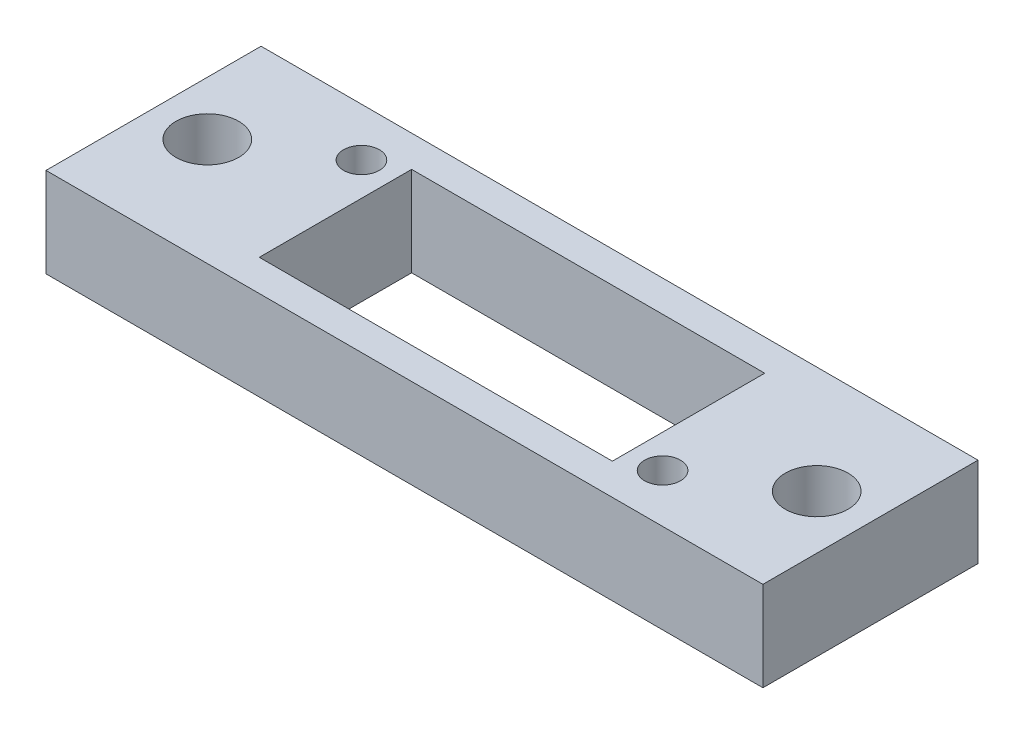
from build123d import *

# Parameters (mm, degrees)
SKETCH_1_W          = 40
SKETCH_1_H          = 12
EXTRUDE_1_DEPTH     = 5
SKETCH_2_W          = 19.7
SKETCH_2_H          = 8.5
CUT_EXTRUDE_1_DEPTH = 5
SKETCH_3_R          = 1
CUT_EXTRUDE_2_DEPTH = 5
SKETCH_4_R          = 1.75
CUT_EXTRUDE_3_DEPTH = 10


with BuildPart() as part:
    # 스케치1 → 보스-돌출1 (new body)
    with BuildSketch(Plane(origin=(0, 0, 0), x_dir=(1, 0, 0), z_dir=(0, 1, 0))):
        Rectangle(SKETCH_1_W, SKETCH_1_H)
    extrude(amount=EXTRUDE_1_DEPTH)

    # 스케치2 → 컷-돌출1 (cut)
    with BuildSketch(Plane(origin=(0, 5, 0), x_dir=(1, 0, 0), z_dir=(0, 1, 0))):
        Rectangle(SKETCH_2_W, SKETCH_2_H)
    extrude(amount=-CUT_EXTRUDE_1_DEPTH, mode=Mode.SUBTRACT)

    # 스케치3 → 컷-돌출2 (cut)
    with BuildSketch(Plane(origin=(0, 5, 0), x_dir=(1, 0, 0), z_dir=(0, 1, 0))):
        with Locations((-11.7, 3.3)):
            Circle(SKETCH_3_R)
        with Locations((11.7, -3.3)):
            Circle(SKETCH_3_R)
    extrude(amount=-CUT_EXTRUDE_2_DEPTH, mode=Mode.SUBTRACT)

    # 스케치4 → 컷-돌출3 (cut)
    with BuildSketch(Plane(origin=(0, 5, 0), x_dir=(1, 0, 0), z_dir=(0, 1, 0))):
        with Locations((-17, 0)):
            Circle(SKETCH_4_R)
        with Locations((17, 0)):
            Circle(SKETCH_4_R)
    extrude(amount=-CUT_EXTRUDE_3_DEPTH, mode=Mode.SUBTRACT)


solid = part.part
